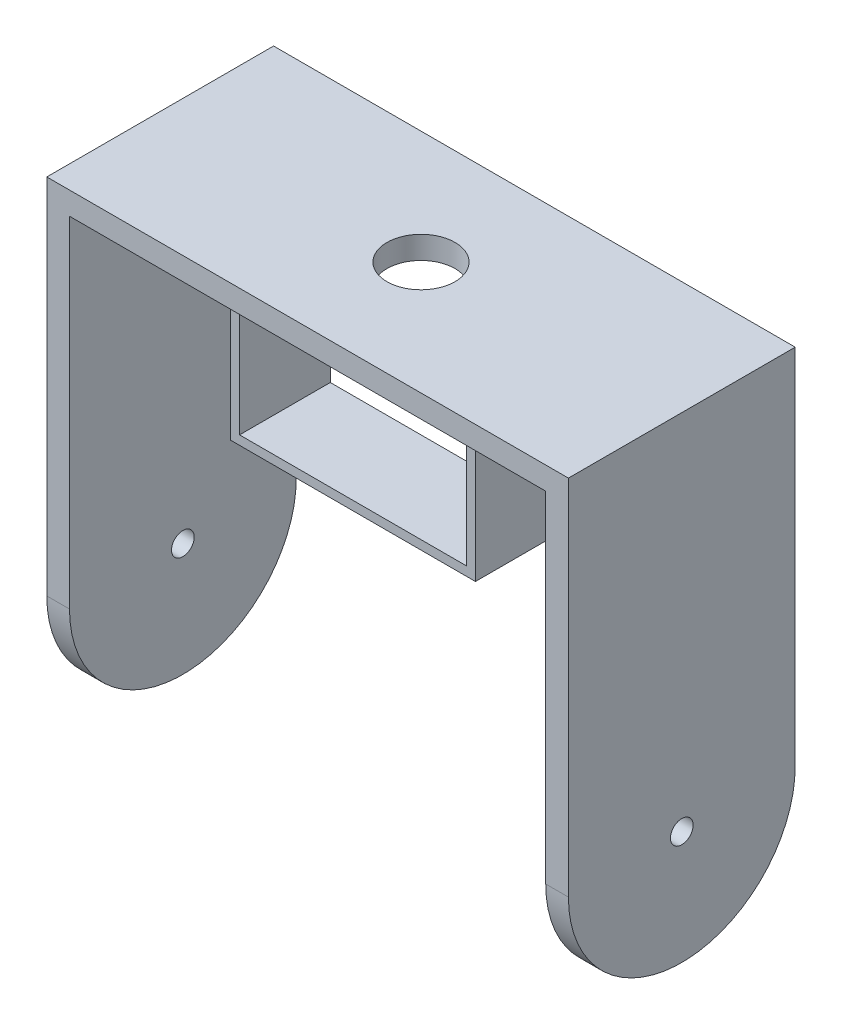
from build123d import *

# Parameters (mm, degrees)
SKETCH2_W              = 115
SKETCH2_H              = 5
BOSS_EXTRUDE1_DEPTH    = 50
SKETCH3_W              = 5
SKETCH3_H              = 50
BOSS_EXTRUDE2_DEPTH    = 100
CUT_EXTRUDE1_DEPTH     = 162.960643367
SKETCH5_R              = 2.5
CUT_EXTRUDE2_DEPTH     = 162.960643367
CUT_EXTRUDE3_START     = -5
CUT_EXTRUDE3_OUTLINE_R = 7.5
CUT_EXTRUDE3_DEPTH     = 5
SKETCH7_W              = 2
SKETCH7_H              = 20
BOSS_EXTRUDE3_DEPTH    = 40
SKETCH8_W              = 20
SKETCH8_H              = 2
BOSS_EXTRUDE4_DEPTH    = 52
BOSS_EXTRUDE6_REACH    = 100.236
SKETCH9_W              = 2
SKETCH9_H              = 20


# Read off the part's stored shape, not the designer's step: Cut-Extrude3
with BuildPart() as part:
    # Sketch2 → Boss-Extrude1 (new body)
    with BuildSketch(Plane.XY):
        Rectangle(SKETCH2_W, SKETCH2_H)
    extrude(amount=-BOSS_EXTRUDE1_DEPTH)

    # Sketch3 → Boss-Extrude2 (add)
    with BuildSketch(Plane.XZ.offset(2.5)):
        with Locations((-55, -25)):
            Rectangle(SKETCH3_W, SKETCH3_H)
        with Locations((55, -25)):
            Rectangle(SKETCH3_W, SKETCH3_H)
    extrude(amount=BOSS_EXTRUDE2_DEPTH)

    # Sketch4 → Cut-Extrude1 (cut, through all)
    with BuildSketch(Plane.ZY.offset(57.5)):
        with BuildLine():
            Line((0, -102.5), (0, -77.5))
            ThreePointArc((0, -77.5), (-7.32233047, -95.17766953), (-25, -102.5))
            Line((-25, -102.5), (0, -102.5))
        make_face()
        with BuildLine():
            ThreePointArc((-25, -102.5), (-42.67766953, -95.17766953), (-50, -77.5))
            Line((-50, -77.5), (-50, -102.5))
            Line((-50, -102.5), (-25, -102.5))
        make_face()
    extrude(amount=-CUT_EXTRUDE1_DEPTH, mode=Mode.SUBTRACT)

    # Sketch5 → Cut-Extrude2 (cut, through all)
    with BuildSketch(Plane.ZY.offset(57.5)):
        with Locations((-25, -77.5)):
            Circle(SKETCH5_R)
    extrude(amount=-CUT_EXTRUDE2_DEPTH, mode=Mode.SUBTRACT)

    # Cut-Extrude3 outline → Cut-Extrude3 (cut)
    with BuildSketch(Plane.XZ.offset(2.5).offset(CUT_EXTRUDE3_START)):
        with Locations((0, -25)):
            Circle(CUT_EXTRUDE3_OUTLINE_R)
    extrude(amount=CUT_EXTRUDE3_DEPTH, mode=Mode.SUBTRACT)

    # Sketch7 → Boss-Extrude3 (add)
    with BuildSketch(Plane.XZ.offset(2.5)):
        with Locations((21, -25)):
            Rectangle(SKETCH7_W, SKETCH7_H)
    extrude(amount=BOSS_EXTRUDE3_DEPTH)

    # Sketch8 → Boss-Extrude4 (add)
    with BuildSketch(Plane.ZY.offset(-20)):
        with Locations((-25, -41.5)):
            Rectangle(SKETCH8_W, SKETCH8_H)
    extrude(amount=BOSS_EXTRUDE4_DEPTH)

    # Sketch9 → Boss-Extrude6 (add, up to next)
    with BuildSketch(Plane(origin=(0, -40.5, 0), x_dir=(1, 0, 0), z_dir=(0, 1, 0)), mode=Mode.PRIVATE) as boss_extrude6_sk1:
        with Locations((-31, 25)):
            Rectangle(SKETCH9_W, SKETCH9_H)
    boss_extrude6_tool1 = extrude(boss_extrude6_sk1.sketch, amount=BOSS_EXTRUDE6_REACH, mode=Mode.PRIVATE) - part.part
    add(boss_extrude6_tool1.solids().sort_by_distance((-31, -40.5, -25))[0])


solid = part.part
